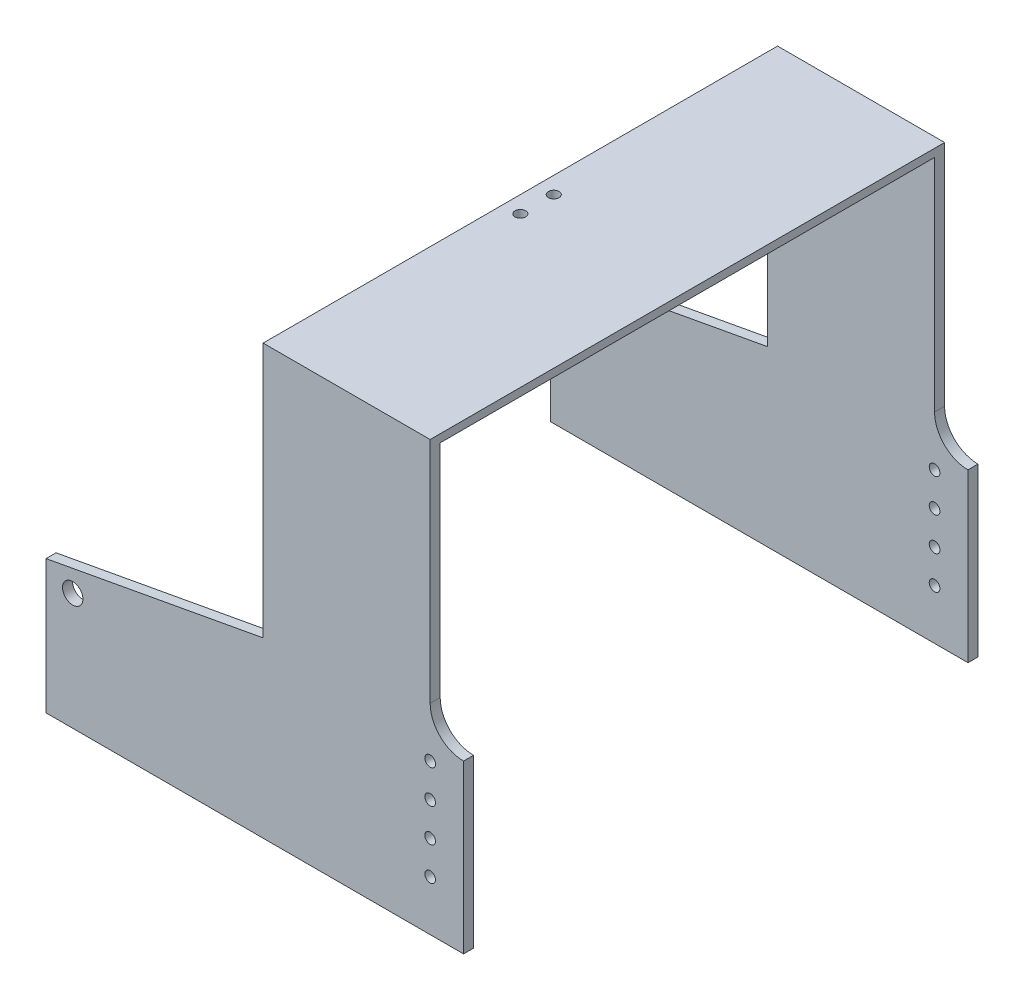
from build123d import *

# Parameters (mm, degrees)
SKETCH_1_R          = 1.6
EXTRUDE_1_DEPTH     = 154
SKETCH_5_R          = 3.05
CUT_EXTRUDE_3_DEPTH = 222.645137515
SKETCH_6_W          = 125
SKETCH_6_H          = 148
CUT_EXTRUDE_5_DEPTH = 126
SKETCH_7_R          = 1.6
CUT_EXTRUDE_6_DEPTH = 119
FILLET_1_R          = 10


with BuildPart() as part:
    # 草图1 → 凸台-拉伸1 (new body)
    with BuildSketch(Plane.XY):
        Polygon((3.292616486, 24.576402747), (3.292616486, -25.423597253), (-121.707383514, -25.423597253), (-121.707383514, 14.576402747), (-56.707383514, 26.515067344), (-56.707383514, 102.946004208), (-6.707383514, 102.946004208), (-6.707383514, 24.576402747), align=None)
        with Locations((-6.707383514, -10.423597253)):
            Circle(SKETCH_1_R, mode=Mode.SUBTRACT)
        with Locations((-6.707383514, -0.423597253)):
            Circle(SKETCH_1_R, mode=Mode.SUBTRACT)
        with Locations((-6.707383514, 9.576402747)):
            Circle(SKETCH_1_R, mode=Mode.SUBTRACT)
        with Locations((-6.707383514, 19.576402747)):
            Circle(SKETCH_1_R, mode=Mode.SUBTRACT)
    extrude(amount=EXTRUDE_1_DEPTH)

    # 草图5 → 切除-拉伸3 (cut, through all)
    with BuildSketch(Plane.XY.offset(154)):
        with Locations((-113.707383514, 9.576402747)):
            Circle(SKETCH_5_R)
    extrude(amount=-CUT_EXTRUDE_3_DEPTH, mode=Mode.SUBTRACT)

    # 草图6 → 切除-拉伸5 (cut)
    with BuildSketch(Plane.XZ.offset(25.423597253)):
        with Locations((-59.207383514, 77)):
            Rectangle(SKETCH_6_W, SKETCH_6_H)
    extrude(amount=-CUT_EXTRUDE_5_DEPTH, mode=Mode.SUBTRACT)

    # 草图7 → 切除-拉伸6 (cut)
    with BuildSketch(Plane(origin=(0, 102.946004208, 0), x_dir=(1, 0, 0), z_dir=(0, 1, 0))):
        with Locations(Location((-51.707383514, -82, 0), (0, 0, 270))):
            Circle(SKETCH_7_R)
        with Locations(Location((-51.707383514, -72, 0), (0, 0, 270))):
            Circle(SKETCH_7_R)
    extrude(amount=-CUT_EXTRUDE_6_DEPTH, mode=Mode.SUBTRACT)

    # 圆角1
    fillet_1_edges = [part.edges().sort_by_distance(p)[0] for p in [
        (-6.707383514, 24.576402747, 1.5),
        (-6.707383514, 24.576402747, 152.5),
    ]]
    fillet(fillet_1_edges, radius=FILLET_1_R - 0.0001)  # a hair under: the kernel refuses the full size


solid = part.part
